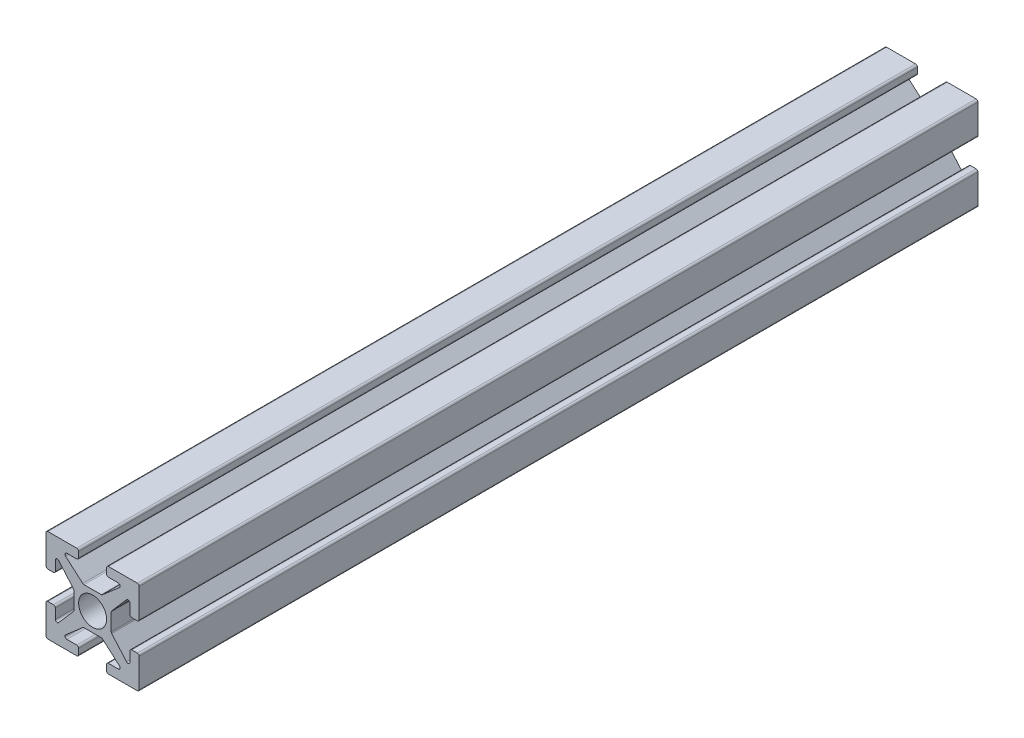
from build123d import *

# Parameters (mm, degrees)
SKETCH1_W           = 10
SKETCH1_H           = 90
BOSS_EXTRUDE1_DEPTH = 10
CUT_EXTRUDE1_DEPTH  = 91.277350426
CUT_EXTRUDE2_DEPTH  = 91.277350426
CUT_EXTRUDE3_DEPTH  = 91.277350426
CUT_EXTRUDE4_DEPTH  = 91.277350426
FILLET1_R           = 0.2


with BuildPart() as part:
    # Sketch1 → Boss-Extrude1 (new body)
    with BuildSketch(Plane(origin=(0, 5, 0), x_dir=(1, 0, 0), z_dir=(0, 1, 0))):
        Rectangle(SKETCH1_W, SKETCH1_H)
    extrude(amount=-BOSS_EXTRUDE1_DEPTH)

    # Sketch2 → Cut-Extrude1 (cut, through all)
    with BuildSketch(Plane.XY.offset(45)):
        with BuildLine():
            Line((5, 1.5), (4, 1.5))
            Line((4, 1.5), (4, 2.759344808))
            ThreePointArc((4, 2.759344808), (3.870199868, 2.946619949), (3.649280215, 2.890811711))
            Line((3.649280215, 2.890811711), (2, 1))
            Line((2, 1), (2, -1))
            Line((2, -1), (3.649280215, -2.890811711))
            ThreePointArc((3.649280215, -2.890811711), (3.870199868, -2.946619949), (4, -2.759344808))
            Line((4, -2.759344808), (4, -1.5))
            Line((4, -1.5), (5, -1.5))
            Line((5, -1.5), (5, 1.5))
        make_face()
    extrude(amount=-CUT_EXTRUDE1_DEPTH, mode=Mode.SUBTRACT)

    # Sketch3 → Cut-Extrude2 (cut, through all)
    with BuildSketch(Plane.XY.offset(45)):
        with BuildLine():
            Line((1.5, -5), (1.5, -4))
            Line((1.5, -4), (2.759344808, -4))
            ThreePointArc((2.759344808, -4), (2.946619949, -3.870199868), (2.890811711, -3.649280215))
            Line((2.890811711, -3.649280215), (1, -2))
            Line((1, -2), (-1, -2))
            Line((-1, -2), (-2.890811711, -3.649280215))
            ThreePointArc((-2.890811711, -3.649280215), (-2.946619949, -3.870199868), (-2.759344808, -4))
            Line((-2.759344808, -4), (-1.5, -4))
            Line((-1.5, -4), (-1.5, -5))
            Line((-1.5, -5), (1.5, -5))
        make_face()
    extrude(amount=-CUT_EXTRUDE2_DEPTH, mode=Mode.SUBTRACT)

    # Sketch4 → Cut-Extrude3 (cut, through all)
    with BuildSketch(Plane.XY.offset(45)):
        with BuildLine():
            Line((-5, -1.5), (-4, -1.5))
            Line((-4, -1.5), (-4, -2.759344808))
            ThreePointArc((-4, -2.759344808), (-3.870199868, -2.946619949), (-3.649280215, -2.890811711))
            Line((-3.649280215, -2.890811711), (-2, -1))
            Line((-2, -1), (-2, 1))
            Line((-2, 1), (-3.649280215, 2.890811711))
            ThreePointArc((-3.649280215, 2.890811711), (-3.870199868, 2.946619949), (-4, 2.759344808))
            Line((-4, 2.759344808), (-4, 1.5))
            Line((-4, 1.5), (-5, 1.5))
            Line((-5, 1.5), (-5, -1.5))
        make_face()
    extrude(amount=-CUT_EXTRUDE3_DEPTH, mode=Mode.SUBTRACT)

    # Sketch5 → Cut-Extrude4 (cut, through all)
    with BuildSketch(Plane.XY.offset(45)):
        with BuildLine():
            Line((-1.5, 5), (-1.5, 4))
            Line((-1.5, 4), (-2.759344808, 4))
            ThreePointArc((-2.759344808, 4), (-2.946619949, 3.870199868), (-2.890811711, 3.649280215))
            Line((-2.890811711, 3.649280215), (-1, 2))
            Line((-1, 2), (1, 2))
            Line((1, 2), (2.890811711, 3.649280215))
            ThreePointArc((2.890811711, 3.649280215), (2.946619949, 3.870199868), (2.759344808, 4))
            Line((2.759344808, 4), (1.5, 4))
            Line((1.5, 4), (1.5, 5))
            Line((1.5, 5), (-1.5, 5))
        make_face()
    extrude(amount=-CUT_EXTRUDE4_DEPTH, mode=Mode.SUBTRACT)

    # Sketch6 → Cut-Revolve1 (revolve, cut)
    with BuildSketch(Plane(origin=(0, 0, 0), x_dir=(1, 0, 0), z_dir=(0, 1, 0))):
        Polygon((1.499999999, 37), (1.25, 36.849784845), (1.25, -36.849784845), (1.499999999, -37), (1.499999999, -45), (0, -45), (0, 45), (1.499999999, 45), align=None)
    revolve(axis=Axis((0, 0, -45), (0, 0, 1)), mode=Mode.SUBTRACT)

    # Fillet1
    fillet1_edges = [part.edges().sort_by_distance(p)[0] for p in [
        (-5, 1.5, 0),
        (1.5, -5, 0),
        (-5, -5, 0),
        (-1.5, 4, 0),
        (2, 1, 0),
        (-4, 1.5, 0),
        (-2, -1, 0),
        (-4, -1.5, 0),
        (-1, -2, 0),
        (-1.5, -4, 0),
        (5, -1.5, 0),
        (1.5, -4, 0),
        (-5, 5, 0),
        (4, -1.5, 0),
        (-2, 1, 0),
        (4, 1.5, 0),
        (-5, -1.5, 0),
        (5, 1.5, 0),
        (-1.5, -5, 0),
        (5, 5, 0),
        (1, -2, 0),
        (1.5, 5, 0),
        (5, -5, 0),
        (1, 2, 0),
        (2, -1, 0),
        (-1, 2, 0),
        (1.5, 4, 0),
        (-1.5, 5, 0),
    ]]
    fillet(fillet1_edges, radius=FILLET1_R)


solid = part.part
